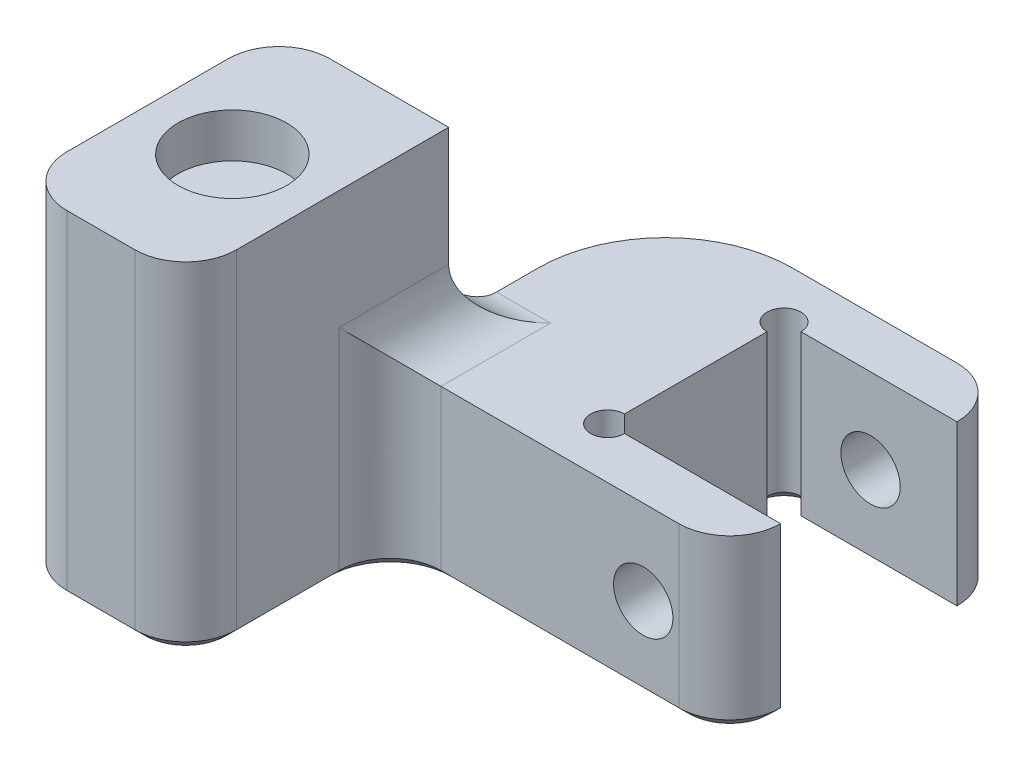
from build123d import *

# Parameters (mm, degrees)
EXTRUDE_1_DEPTH     = 10
SKETCH_2_R          = 1.75
CUT_EXTRUDE_1_DEPTH = 32.463731502
SKETCH_3_W          = 10
SKETCH_3_H          = 15.5
EXTRUDE_2_DEPTH     = 10
SKETCH_4_R          = 3.2
CUT_EXTRUDE_2_DEPTH = 2.6
SKETCH_5_R          = 1
CUT_EXTRUDE_3_DEPTH = 34.631367799
FILLET_1_R          = 3
FILLET_2_R          = 3
CHAMFER_1_SIZE      = 0.6
FILLET_3_R          = 7.5


# Some blends are built 0.0001 mm under size
with BuildPart() as part:
    # ｽｹｯﾁ1 → ﾎﾞｽ - 押し出し1 (new body)
    with BuildSketch(Plane(origin=(0, 0, 0), x_dir=(1, 0, 0), z_dir=(0, 1, 0))):
        Polygon((-15.1, -8.2), (5.1, -8.2), (5.1, -5.2), (-5.1, -5.2), (-5.1, 5.2), (5.1, 5.2), (5.1, 8.2), (-15.1, 8.2), align=None)
        Polygon((-15.1, -8.2), (-15.1, -4.75), (-24.92, -4.75), (-24.92, -20.25), (-14.92, -20.25), (-14.92, -8.2), align=None)
    extrude(amount=EXTRUDE_1_DEPTH)

    # ｽｹｯﾁ2 → ｶｯﾄ - 押し出し1 (cut, through all)
    with BuildSketch(Plane.XY.offset(8.2)):
        with Locations((0, 5)):
            Circle(SKETCH_2_R)
    extrude(amount=-CUT_EXTRUDE_1_DEPTH, mode=Mode.SUBTRACT)

    # ｽｹｯﾁ3 → ﾎﾞｽ - 押し出し2 (add)
    with BuildSketch(Plane(origin=(0, 10, 0), x_dir=(1, 0, 0), z_dir=(0, 1, 0))):
        with Locations((-19.92, -12.5)):
            Rectangle(SKETCH_3_W, SKETCH_3_H)
    extrude(amount=EXTRUDE_2_DEPTH)

    # ｽｹｯﾁ4 → ｶｯﾄ - 押し出し2 (cut)
    with BuildSketch(Plane(origin=(0, 20, 0), x_dir=(1, 0, 0), z_dir=(0, 1, 0))):
        with Locations(Location((-19.92, -12.5, 0), (0, 0, 270))):
            Circle(SKETCH_4_R)
    extrude(amount=-CUT_EXTRUDE_2_DEPTH, mode=Mode.SUBTRACT)

    # ｽｹｯﾁ5 → ｶｯﾄ - 押し出し3 (cut, through all)
    with BuildSketch(Plane(origin=(0, 10, 0), x_dir=(1, 0, 0), z_dir=(0, 1, 0))):
        with Locations((-5.1, 5.2)):
            Circle(SKETCH_5_R)
        with Locations((-5.1, -5.2)):
            Circle(SKETCH_5_R)
    extrude(amount=-CUT_EXTRUDE_3_DEPTH, mode=Mode.SUBTRACT)

    # ﾌｨﾚｯﾄ1
    fillet_1_edges = [part.edges().sort_by_distance(p)[0] for p in [
        (-14.92, 10, 20.25),
        (-24.92, 10, 20.25),
        (-24.92, 10, 4.75),
        (-15.1, 5, 4.75),
        (5.1, 5, -8.2),
        (5.1, 5, 8.2),
        (-14.92, 10, 6.475),
        (-14.92, 5, 8.2),
    ]]
    fillet(fillet_1_edges, radius=FILLET_1_R - 0.0001)  # a hair under: the kernel refuses the full size

    # ﾌｨﾚｯﾄ2
    fillet_2_edges = [part.edges().sort_by_distance(p)[0] for p in [
        (-15.01, 10, 4.75),
    ]]
    fillet(fillet_2_edges, radius=FILLET_2_R - 0.0001)  # a hair under: the kernel refuses the full size

    # 面取り1
    # the kernel refuses this chamfer: 0.6 mm, written as the material it takes off along each edge
    with BuildSketch(Plane(origin=(-18.0999, 0, 1.7501), x_dir=(0, 0, 1), z_dir=(-1, 0, 0))) as chamfer_1_piece_1:
        Polygon((2.9999, CHAMFER_1_SIZE), (2.9999 + CHAMFER_1_SIZE, 0), (2.9999, 0), align=None)
    revolve(axis=Axis((-18.0999, 0, 1.7501), (0, 1, 0)), revolution_arc=90, mode=Mode.SUBTRACT)
    with BuildSketch(Plane(origin=(-11.9201, 0, 11.1999), x_dir=(0, 0, -1), z_dir=(1, 0, 0))) as chamfer_1_piece_2:
        Polygon((2.9999, CHAMFER_1_SIZE), (2.9999 + CHAMFER_1_SIZE, 0), (2.9999, 0), align=None)
    revolve(axis=Axis((-11.9201, 0, 11.1999), (0, 1, 0)), revolution_arc=90, mode=Mode.SUBTRACT)
    with BuildSketch(Plane(origin=(-15.1, 0, -9.743009793), x_dir=(-0.027495876610587354, 0.9996219169112968, 0), z_dir=(0, 0, 1))) as chamfer_1_piece_3:
        Polygon((CHAMFER_1_SIZE * 0.999621916911, -CHAMFER_1_SIZE * 0.0274958766106), (-CHAMFER_1_SIZE * 0.0274958766106, -CHAMFER_1_SIZE * 0.999621916911), (0, 0), align=None)
    extrude(amount=11.493109793, mode=Mode.SUBTRACT)
    with BuildSketch(Plane(origin=(-5.643009793, 0, -5.2), x_dir=(0, 0.9996219169112968, 0.027495876610585914), z_dir=(1, 0, 0)), Plane(origin=(6.643009793, 0, 5.2), x_dir=(0, 0.9996219169112968, -0.027495876610585914), z_dir=(-1, 0, 0))) as chamfer_1_piece_4:
        Polygon((CHAMFER_1_SIZE * 0.999621916911, -CHAMFER_1_SIZE * 0.0274958766106), (-CHAMFER_1_SIZE * 0.0274958766106, -CHAMFER_1_SIZE * 0.999621916911), (0, 0), align=None)
    extrude(amount=12.286019586, mode=Mode.SUBTRACT)
    with BuildSketch(Plane(origin=(-5.1, 0, 5.743009793), x_dir=(0.027495876610585914, 0.9996219169112968, 0), z_dir=(0, 0, -1))) as chamfer_1_piece_5:
        Polygon((CHAMFER_1_SIZE * 0.999621916911, -CHAMFER_1_SIZE * 0.0274958766106), (-CHAMFER_1_SIZE * 0.0274958766106, -CHAMFER_1_SIZE * 0.999621916911), (0, 0), align=None)
    extrude(amount=11.486019586, mode=Mode.SUBTRACT)
    with BuildSketch(Plane(origin=(-5.1, 0, 5.2), x_dir=(0.7048818539423609, 0, -0.7093247295722744), z_dir=(0.7093247295722744, 0, 0.7048818539423609))) as chamfer_1_piece_6:
        Polygon((1, CHAMFER_1_SIZE), (1 + CHAMFER_1_SIZE, 0), (1, 0), align=None)
    revolve(axis=Axis((-5.1, 0, 5.2), (0, 1, 0)), revolution_arc=359.64, mode=Mode.SUBTRACT)
    with BuildSketch(Plane(origin=(-5.1, 0, -5.2), x_dir=(0.7093247295722735, 0, 0.7048818539423618), z_dir=(-0.7048818539423618, 0, 0.7093247295722735))) as chamfer_1_piece_7:
        Polygon((1, CHAMFER_1_SIZE), (1 + CHAMFER_1_SIZE, 0), (1, 0), align=None)
    revolve(axis=Axis((-5.1, 0, -5.2), (0, 1, 0)), revolution_arc=359.64, mode=Mode.SUBTRACT)
    with BuildSketch(Plane(origin=(-14.92, 0, 17.2501), x_dir=(0.027495876610587354, 0.9996219169112968, 0), z_dir=(0, 0, -1))) as chamfer_1_piece_8:
        Polygon((CHAMFER_1_SIZE * 0.999621916911, -CHAMFER_1_SIZE * 0.0274958766106), (-CHAMFER_1_SIZE * 0.0274958766106, -CHAMFER_1_SIZE * 0.999621916911), (0, 0), align=None)
    extrude(amount=6.0502, mode=Mode.SUBTRACT)
    with BuildSketch(Plane(origin=(-11.9201, 0, 8.2), x_dir=(0, 0.9996219169112968, 0.027495876610587354), z_dir=(1, 0, 0))) as chamfer_1_piece_9:
        Polygon((CHAMFER_1_SIZE * 0.999621916911, -CHAMFER_1_SIZE * 0.0274958766106), (-CHAMFER_1_SIZE * 0.0274958766106, -CHAMFER_1_SIZE * 0.999621916911), (0, 0), align=None)
    extrude(amount=14.0202, mode=Mode.SUBTRACT)
    with BuildSketch(Plane(origin=(-21.9201, 0, 20.25), x_dir=(0, 0.9996219169112968, 0.027495876610584478), z_dir=(1, 0, 0))) as chamfer_1_piece_10:
        Polygon((CHAMFER_1_SIZE * 0.999621916911, -CHAMFER_1_SIZE * 0.0274958766106), (-CHAMFER_1_SIZE * 0.0274958766106, -CHAMFER_1_SIZE * 0.999621916911), (0, 0), align=None)
    extrude(amount=4.0002, mode=Mode.SUBTRACT)
    with BuildSketch(Plane(origin=(-24.92, 0, 7.7499), x_dir=(-0.027495876610584478, 0.9996219169112968, 0), z_dir=(0, 0, 1))) as chamfer_1_piece_11:
        Polygon((CHAMFER_1_SIZE * 0.999621916911, -CHAMFER_1_SIZE * 0.0274958766106), (-CHAMFER_1_SIZE * 0.0274958766106, -CHAMFER_1_SIZE * 0.999621916911), (0, 0), align=None)
    extrude(amount=9.5002, mode=Mode.SUBTRACT)
    with BuildSketch(Plane(origin=(-18.0999, 0, 4.75), x_dir=(0, -0.02749587661058641, 0.9996219169112968), z_dir=(-1, 0, 0))) as chamfer_1_piece_12:
        Polygon((CHAMFER_1_SIZE * 0.999621916911, CHAMFER_1_SIZE * 0.0274958766106), (-CHAMFER_1_SIZE * 0.0274958766106, CHAMFER_1_SIZE * 0.999621916911), (0, 0), align=None)
    extrude(amount=3.8202, mode=Mode.SUBTRACT)
    with BuildSketch(Plane(origin=(2.1001, 0, -8.2), x_dir=(0, 0.9996219169112968, -0.027495876610587354), z_dir=(-1, 0, 0))) as chamfer_1_piece_13:
        Polygon((CHAMFER_1_SIZE * 0.999621916911, -CHAMFER_1_SIZE * 0.0274958766106), (-CHAMFER_1_SIZE * 0.0274958766106, -CHAMFER_1_SIZE * 0.999621916911), (0, 0), align=None)
    extrude(amount=18.743109793, mode=Mode.SUBTRACT)
    with BuildSketch(Plane(origin=(2.1001, 0, 5.2001), x_dir=(0, 0, 1), z_dir=(-1, 0, 0))) as chamfer_1_piece_14:
        Polygon((2.9999, CHAMFER_1_SIZE), (2.9999 - CHAMFER_1_SIZE, 0), (2.9999, 0), align=None)
    revolve(axis=Axis((2.1001, 0, 5.2001), (0, 1, 0)), revolution_arc=90, mode=Mode.SUBTRACT)
    with BuildSketch(Plane(origin=(2.1001, 0, -5.2001), x_dir=(0, 0, -1), z_dir=(-1, 0, 0))) as chamfer_1_piece_15:
        Polygon((2.9999, -CHAMFER_1_SIZE), (2.9999 - CHAMFER_1_SIZE, 0), (2.9999, 0), align=None)
    revolve(axis=Axis((2.1001, 0, -5.2001), (0, -1, 0)), revolution_arc=90, mode=Mode.SUBTRACT)
    with BuildSketch(Plane(origin=(-21.9201, 0, 7.7499), x_dir=(-1, 0, 0), z_dir=(0, 0, 1))) as chamfer_1_piece_16:
        Polygon((2.9999, -CHAMFER_1_SIZE), (2.9999 - CHAMFER_1_SIZE, 0), (2.9999, 0), align=None)
    revolve(axis=Axis((-21.9201, 0, 7.7499), (0, -1, 0)), revolution_arc=90, mode=Mode.SUBTRACT)
    with BuildSketch(Plane(origin=(-21.9201, 0, 17.2501), x_dir=(0, 0, 1), z_dir=(1, 0, 0))) as chamfer_1_piece_17:
        Polygon((2.9999, -CHAMFER_1_SIZE), (2.9999 - CHAMFER_1_SIZE, 0), (2.9999, 0), align=None)
    revolve(axis=Axis((-21.9201, 0, 17.2501), (0, -1, 0)), revolution_arc=90, mode=Mode.SUBTRACT)
    with BuildSketch(Plane(origin=(-17.9199, 0, 17.2501), x_dir=(1, 0, 0), z_dir=(0, 0, -1))) as chamfer_1_piece_18:
        Polygon((2.9999, -CHAMFER_1_SIZE), (2.9999 - CHAMFER_1_SIZE, 0), (2.9999, 0), align=None)
    revolve(axis=Axis((-17.9199, 0, 17.2501), (0, -1, 0)), revolution_arc=90, mode=Mode.SUBTRACT)
    with BuildSketch(Plane(origin=(5.1, 0, -3.656990207), x_dir=(0.027495876610585918, 0.9996219169112968, 0), z_dir=(0, 0, -1)), Plane(origin=(5.1, 0, 5.2001), x_dir=(0.027495876610585918, 0.9996219169112968, 0), z_dir=(0, 0, -1))) as chamfer_1_piece_19:
        Polygon((CHAMFER_1_SIZE * 0.999621916911, -CHAMFER_1_SIZE * 0.0274958766106), (-CHAMFER_1_SIZE * 0.0274958766106, -CHAMFER_1_SIZE * 0.999621916911), (0, 0), align=None)
    extrude(amount=1.543109793, mode=Mode.SUBTRACT)

    # ﾌｨﾚｯﾄ3
    # the kernel refuses this fillet: 7.5 mm, written as the material it takes off along each edge
    with BuildSketch(Plane(origin=(-15.1, -18.15, -8.2), x_dir=(0, 0, 1), z_dir=(0, 1, 0))) as fillet_3_piece_1:
        with BuildLine():
            CenterArc((FILLET_3_R, FILLET_3_R), FILLET_3_R, 180, 90)
            Line((0, FILLET_3_R), (0, 0))
            Line((0, 0), (FILLET_3_R, 0))
        make_face()
    extrude(amount=46.9, mode=Mode.SUBTRACT)


solid = part.part
